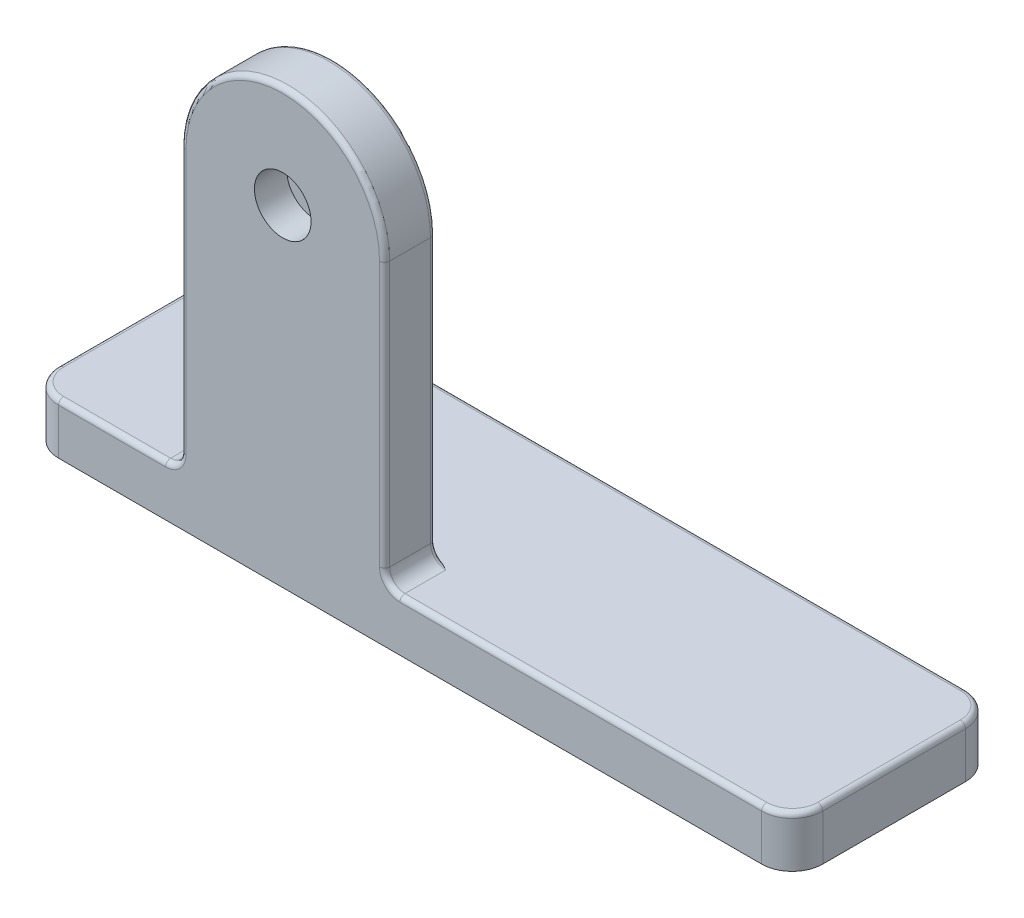
from build123d import *

# Parameters (mm, degrees)
SKETCH1_W                                        = 150
SKETCH1_H                                        = 40
BOSS_EXTRUDE1_DEPTH                              = 10
BOSS_EXTRUDE2_DEPTH                              = 10
CBORE_FOR_1_4_SOCKET_HEAD_CAP_SCREW1_D           = 6.7564
CBORE_FOR_1_4_SOCKET_HEAD_CAP_SCREW1_CBORE_D     = 11.1125
CBORE_FOR_1_4_SOCKET_HEAD_CAP_SCREW1_CBORE_DEPTH = 6.35
FILLET1_R                                        = 6
FILLET2_R                                        = 3
FILLET3_R                                        = 1
SHELL4_START                                     = -14
SHELL4_OUTLINE_W                                 = 146
SHELL4_OUTLINE_H                                 = 8
SHELL4_DEPTH                                     = 28
SHELL4_START_2                                   = 12
SHELL4_2_OUTLINE_R                               = 7.55625
SHELL4_2_DEPTH                                   = 6
SHELL4_3_DEPTH                                   = 8


with BuildPart() as part:
    # Sketch1 → Boss-Extrude1 (new body)
    with BuildSketch(Plane(origin=(0, 0, 0), x_dir=(1, 0, 0), z_dir=(0, 1, 0))):
        Rectangle(SKETCH1_W, SKETCH1_H)
    extrude(amount=BOSS_EXTRUDE1_DEPTH)

    # Sketch2 → Boss-Extrude2 (add)
    with BuildSketch(Plane.XY.offset(20)):
        with BuildLine():
            Line((-45, 0), (-5, 0))
            Line((-5, 0), (-5, 65))
            ThreePointArc((-5, 65), (-25, 85), (-45, 65))
            Line((-45, 65), (-45, 0))
        make_face()
    extrude(amount=-BOSS_EXTRUDE2_DEPTH)

    # CBORE for 1/4 Socket Head Cap Screw1 (through all)
    with Locations(Plane.XY.offset(20)):
        with Locations((-25, 65)):
            CounterBoreHole(CBORE_FOR_1_4_SOCKET_HEAD_CAP_SCREW1_D / 2, CBORE_FOR_1_4_SOCKET_HEAD_CAP_SCREW1_CBORE_D / 2, CBORE_FOR_1_4_SOCKET_HEAD_CAP_SCREW1_CBORE_DEPTH)

    # Fillet1
    fillet1_edges = [part.edges().sort_by_distance(p)[0] for p in [
        (-75, 5, -20),
        (75, 5, -20),
        (75, 5, 20),
        (-75, 5, 20),
    ]]
    fillet(fillet1_edges, radius=FILLET1_R)

    # Fillet2
    fillet2_edges = [part.edges().sort_by_distance(p)[0] for p in [
        (-45, 10, 15),
        (-5, 10, 15),
    ]]
    fillet(fillet2_edges, radius=FILLET2_R)

    # Fillet3
    fillet3_edges = [part.edges().sort_by_distance(p)[0] for p in [
        (-45, 39, 10),
        (-25, 85, 10),
        (-45, 39, 20),
        (-25, 85, 20),
        (0, 10, -20),
        (75, 10, 0),
        (-75, 10, 0),
        (-58.5, 10, 20),
        (73.242640687, 10, 18.242640687),
        (-73.242640687, 10, 18.242640687),
        (-73.242640687, 10, -18.242640687),
        (73.242640687, 10, -18.242640687),
        (33.5, 10, 20),
        (-5, 39, 20),
        (-5, 39, 10),
        (-45.878679656, 10.878679656, 20),
        (-45.878679656, 10.878679656, 10),
        (-4.121320344, 10.878679656, 10),
        (-4.121320344, 10.878679656, 20),
    ]]
    fillet(fillet3_edges, radius=FILLET3_R)

    # Shell4: read off the stored shape, not the designer's step
    # Shell4 outline → Shell4 (cut)
    with BuildSketch(Plane.XY.offset(SHELL4_START)):
        with Locations((0, 4)):
            Rectangle(SHELL4_OUTLINE_W, SHELL4_OUTLINE_H)
    extrude(amount=SHELL4_DEPTH, mode=Mode.SUBTRACT)

    # Shell4 2 outline → Shell4 2 (cut)
    with BuildSketch(Plane.XY.offset(SHELL4_START_2)):
        with BuildLine():
            ThreePointArc((-43, 13), (-44.464466094, 9.464466094), (-48, 8))
            Line((-48, 8), (-2, 8))
            ThreePointArc((-2, 8), (-5.535533906, 9.464466094), (-7, 13))
            Line((-7, 13), (-7, 65))
            ThreePointArc((-7, 65), (-25, 83), (-43, 65))
            Line((-43, 65), (-43, 13))
        make_face()
        with Locations((-25, 65)):
            Circle(SHELL4_2_OUTLINE_R, mode=Mode.SUBTRACT)
    extrude(amount=SHELL4_2_DEPTH, mode=Mode.SUBTRACT)

    # Shell4 3 outline → Shell4 3 (cut)
    with BuildSketch(Plane(origin=(0, 0, 0), x_dir=(1, 0, 0), z_dir=(0, 1, 0))):
        with BuildLine():
            Line((-69, -18), (69, -18))
            ThreePointArc((69, -18), (71.828427125, -16.828427125), (73, -14))
            Line((73, -14), (-73, -14))
            ThreePointArc((-73, -14), (-71.828427125, -16.828427125), (-69, -18))
        make_face()
        with BuildLine():
            Line((69, 18), (-69, 18))
            ThreePointArc((-69, 18), (-71.828427125, 16.828427125), (-73, 14))
            Line((-73, 14), (73, 14))
            ThreePointArc((73, 14), (71.828427125, 16.828427125), (69, 18))
        make_face()
    extrude(amount=SHELL4_3_DEPTH, mode=Mode.SUBTRACT)


solid = part.part
